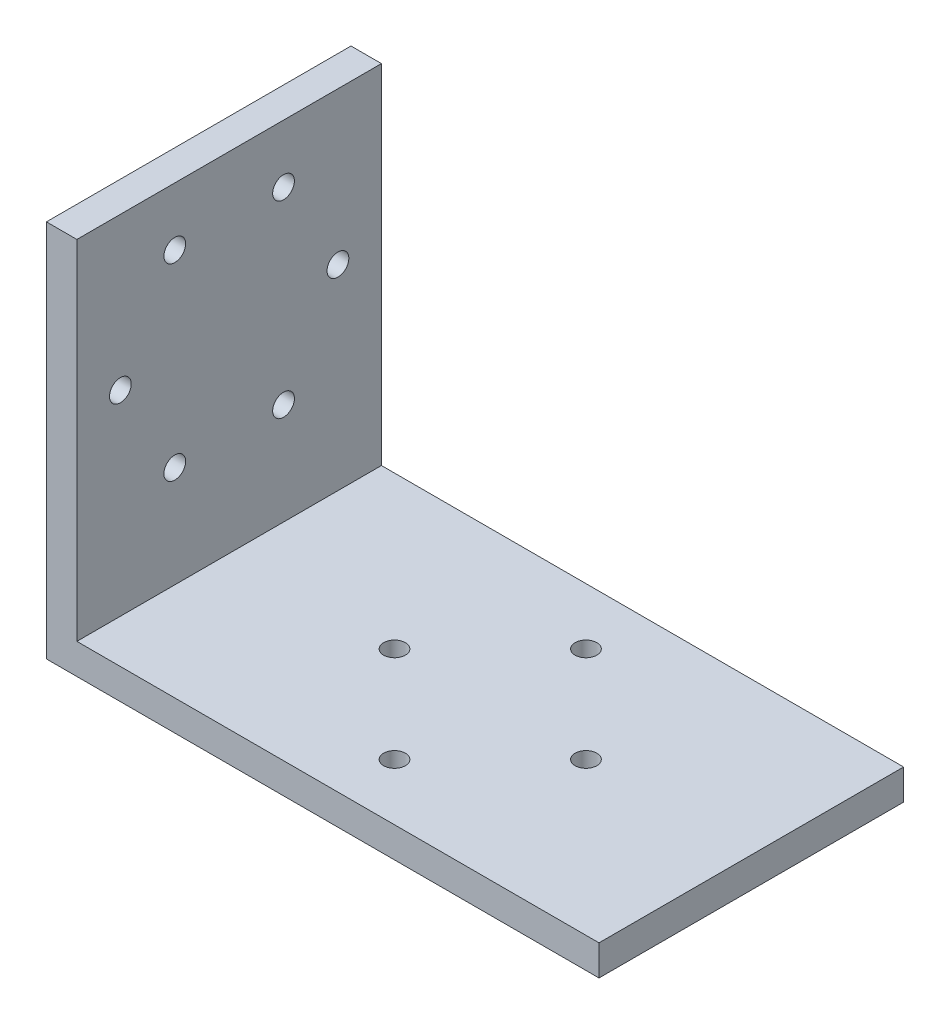
from build123d import *

# Parameters (mm, degrees)
SKETCH_1_W          = 120
SKETCH_1_H          = 70
EXTRUDE_1_DEPTH     = 7
SKETCH_2_R          = 2.5
CUT_EXTRUDE_2_DEPTH = 7
SKETCH_5_W          = 70
SKETCH_5_H          = 87
EXTRUDE_4_DEPTH     = 7
SKETCH_6_R          = 2.5
CUT_EXTRUDE_3_DEPTH = 7


with BuildPart() as part:
    # 草图1 → 凸台-拉伸1 (new body)
    with BuildSketch(Plane(origin=(0, 0, 0), x_dir=(1, 0, 0), z_dir=(0, 1, 0))):
        with Locations((60, 35)):
            Rectangle(SKETCH_1_W, SKETCH_1_H)
    extrude(amount=EXTRUDE_1_DEPTH)

    # 草图2 → 切除-拉伸2 (cut)
    with BuildSketch(Plane(origin=(0, 7, 0), x_dir=(1, 0, 0), z_dir=(0, 1, 0))):
        with Locations((82, 35)):
            Circle(SKETCH_2_R)
        with Locations((60, 13)):
            Circle(SKETCH_2_R)
        with Locations((38, 35)):
            Circle(SKETCH_2_R)
        with Locations((60, 57)):
            Circle(SKETCH_2_R)
    extrude(amount=-CUT_EXTRUDE_2_DEPTH, mode=Mode.SUBTRACT)

    # 草图5 → 凸台-拉伸4 (add)
    with BuildSketch(Plane.ZY):
        with Locations((-35, 43.5)):
            Rectangle(SKETCH_5_W, SKETCH_5_H)
    extrude(amount=EXTRUDE_4_DEPTH)

    # 草图6 → 切除-拉伸3 (cut)
    with BuildSketch(Plane.ZY.offset(7)):
        with Locations((-10, 52)):
            Circle(SKETCH_6_R)
        with Locations((-22.5, 30.349364905)):
            Circle(SKETCH_6_R)
        with Locations((-47.5, 30.349364905)):
            Circle(SKETCH_6_R)
        with Locations((-60, 52)):
            Circle(SKETCH_6_R)
        with Locations((-47.5, 73.650635095)):
            Circle(SKETCH_6_R)
        with Locations((-22.5, 73.650635095)):
            Circle(SKETCH_6_R)
    extrude(amount=-CUT_EXTRUDE_3_DEPTH, mode=Mode.SUBTRACT)


solid = part.part
